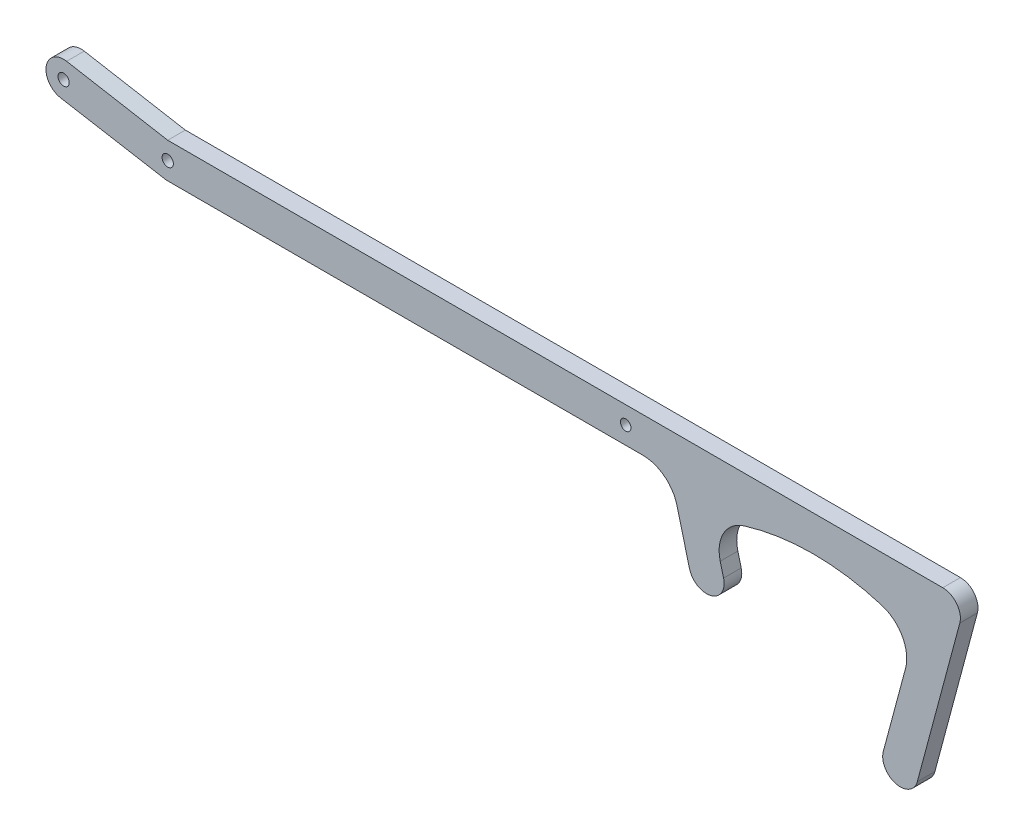
from build123d import *

# Parameters (mm, degrees)
SKETCH1_R           = 2.032
SKETCH1_R_2         = 1.905
BOSS_EXTRUDE1_DEPTH = 3.175
FILLET1_R           = 12.7
FILLET2_R           = 12.7


with BuildPart() as part:
    # Sketch1 → Boss-Extrude1 (new, symmetric)
    with BuildSketch(Plane.XY):
        with BuildLine():
            Line((0, 6.35), (279.4, 6.35))
            ThreePointArc((279.4, 6.35), (284.437793711, 3.865635074), (285.533628997, -1.643500936))
            Line((285.533628997, -1.643500936), (270.220332649, -58.793500936))
            ThreePointArc((270.220332649, -58.793500936), (262.443202716, -63.283628997), (257.953074656, -55.506499064))
            Line((257.953074656, -55.506499064), (268.912598299, -14.605))
            ThreePointArc((268.912598299, -14.605), (232.640366893, -6.419077966), (196.368135487, -14.605))
            Line((196.368135487, -14.605), (200.385064715, -30.1625))
            ThreePointArc((200.385064715, -30.1625), (195.824203653, -37.898361062), (188.08834259, -33.3375))
            Line((188.08834259, -33.3375), (181.120200053, -6.35))
            Line((181.120200053, -6.35), (0, -6.35))
            ThreePointArc((0, -6.35), (-0.545429878, -6.326531929), (-1.0868282, -6.256301181))
            Line((-1.0868282, -6.256301181), (-38.624635284, 0.264668019))
            ThreePointArc((-38.624635284, 0.264668019), (-43.792727303, 7.615717142), (-36.435141156, 12.774498432))
            Line((-36.435141156, 12.774498432), (0, 6.35))
        make_face()
        Circle(SKETCH1_R, mode=Mode.SUBTRACT)
        with Locations((165.1, 0)):
            Circle(SKETCH1_R_2, mode=Mode.SUBTRACT)
        with Locations((-37.537807084, 6.5209692)):
            Circle(SKETCH1_R, mode=Mode.SUBTRACT)
    extrude(amount=BOSS_EXTRUDE1_DEPTH, both=True)

    # Fillet1
    fillet1_edges = [part.edges().sort_by_distance(p)[0] for p in [
        (181.120200053, -6.35, 0),
    ]]
    fillet(fillet1_edges, radius=FILLET1_R)

    # Fillet2
    fillet2_edges = [part.edges().sort_by_distance(p)[0] for p in [
        (268.912598299, -14.605, 0),
        (196.368135487, -14.605, 0),
    ]]
    fillet(fillet2_edges, radius=FILLET2_R)


solid = part.part
